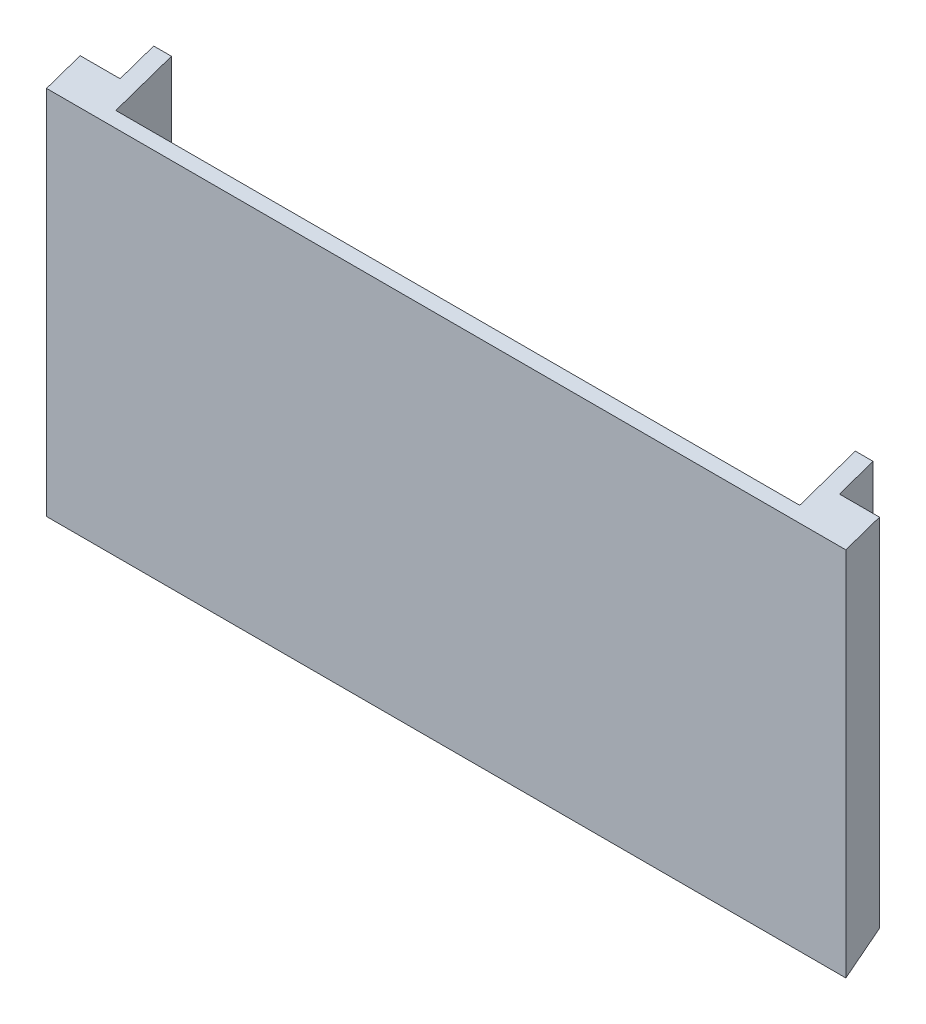
from build123d import *

# Parameters (mm, degrees)
SALIENTE_EXTRUIR1_START    = -22.283463782
SALIENTE_EXTRUIR1_DEPTH    = 135
SALIENTE_EXTRUIR2_START    = -15.533463782
SALIENTE_EXTRUIR2_DEPTH    = 121.5
SALIENTE_EXTRUIR2_2_DEPTH  = 3
SALIENTE_EXTRUIR2_START_2  = 102.966536218
SALIENTE_EXTRUIR2_3_DEPTH  = 3
CORTAR_EXTRUIR1_DEPTH      = 10
CORTAR_EXTRUIR1_DEPTH_BACK = 148
CHAFL_N1_SIZE              = 5
CHAFL_N1_SIZE2             = 3.934668741
CROQUIS5_W                 = 11.5
CROQUIS5_H                 = 16.108624933
SALIENTE_EXTRUIR3_DEPTH    = 8
CORTAR_EXTRUIR2_DEPTH      = 14.8
REDONDEO1_R                = 3
CROQUIS7_R                 = 2
CROQUIS7_R_2               = 3
CROQUIS7_R_3               = 1.25
SALIENTE_EXTRUIR4_DEPTH    = 5


# Read off the part's stored shape, not the designer's step: Saliente-Extruir1, Saliente-Extruir2
with BuildPart() as part:
    # Saliente-Extruir1 outline → Saliente-Extruir1 (new body)
    with BuildSketch(Plane.YZ.offset(SALIENTE_EXTRUIR1_START)):
        Polygon((-75.458190571, 5.674155302), (-73.507815836, 0), (-2.064199728, 0), (-4.014574463, 5.674155302), align=None)
    extrude(amount=SALIENTE_EXTRUIR1_DEPTH)

    # Saliente-Extruir2 outline → Saliente-Extruir2 (add)
    with BuildSketch(Plane.YZ.offset(SALIENTE_EXTRUIR2_START)):
        Polygon((-63.757815836, 0), (-66.757815836, 0), (-64.807441101, -5.674155302), (-61.807441101, -5.674155302), align=None)
    extrude(amount=SALIENTE_EXTRUIR2_DEPTH)

    # Saliente-Extruir2 2 outline → Saliente-Extruir2 2 (add)
    with BuildSketch(Plane.YZ.offset(SALIENTE_EXTRUIR2_START)):
        Polygon((-2.064199728, 0), (-63.757815836, 0), (-61.807441101, -5.674155302), (-0.113824993, -5.674155302), align=None)
    extrude(amount=SALIENTE_EXTRUIR2_2_DEPTH)

    # Saliente-Extruir2 3 outline → Saliente-Extruir2 3 (add)
    with BuildSketch(Plane.YZ.offset(SALIENTE_EXTRUIR2_START_2)):
        Polygon((-2.064199728, 0), (-63.757815836, 0), (-61.807441101, -5.674155302), (-0.113824993, -5.674155302), align=None)
    extrude(amount=SALIENTE_EXTRUIR2_3_DEPTH)

    # Croquis3 → Cortar-Extruir1 (cut, two sides: drawn at the far end of the back side and taken through both)
    with BuildSketch(Plane(origin=(105.966536218, 0, 0), x_dir=(0, 0, -1), z_dir=(1, 0, 0)).offset(-CORTAR_EXTRUIR1_DEPTH_BACK)):
        Polygon((137.63492959, 43.681305963), (7.625291737, -57.488760722), (7.625291737, -67.23888859), (-5.407688567, -80.271868893), (-9.341803419, -77.990953795), (-7.87522913, -69.550856699), (-8.264975448, -68.650724899), (138.464177577, 45.530026939), align=None)
    extrude(amount=CORTAR_EXTRUIR1_DEPTH + CORTAR_EXTRUIR1_DEPTH_BACK, mode=Mode.SUBTRACT)

    # Chaflán1
    chafl_n1_edges = [part.edges().sort_by_distance(p)[0] for p in [
        (45.216536218, -2.064199728, 0),
    ]]
    chafl_n1_side = [part.faces().sort_by_distance(p)[0] for p in [
        (45.216536218, -32.141669504, 0),
    ]]
    chamfer(chafl_n1_edges, length=CHAFL_N1_SIZE, length2=CHAFL_N1_SIZE2, reference=chafl_n1_side[0])

    # Croquis5 → Saliente-Extruir3 (add)
    with BuildSketch(Plane(origin=(0, 0, 0), x_dir=(-1, 0, 0), z_dir=(0, 0, -1))):
        with Locations((-44.930876317, -31.711417234)):
            Rectangle(CROQUIS5_W, CROQUIS5_H)
    extrude(amount=SALIENTE_EXTRUIR3_DEPTH)

    # Croquis6 → Cortar-Extruir2 (cut)
    with BuildSketch(Plane(origin=(50.680876317, 0, 0), x_dir=(0, 0, -1), z_dir=(1, 0, 0))):
        with BuildLine():
            Line((5.9, -36.7657297), (5.9, -26.657104767))
            ThreePointArc((5.9, -26.657104767), (4, -24.757104767), (2.1, -26.657104767))
            Line((2.1, -26.657104767), (2.1, -36.7657297))
            ThreePointArc((2.1, -36.7657297), (4, -38.6657297), (5.9, -36.7657297))
        make_face()
    extrude(amount=-CORTAR_EXTRUIR2_DEPTH, mode=Mode.SUBTRACT)

    # Redondeo1
    redondeo1_edges = [part.edges().sort_by_distance(p)[0] for p in [
        (44.930876317, -23.657104767, -8),
        (44.930876317, -39.7657297, -8),
    ]]
    fillet(redondeo1_edges, radius=REDONDEO1_R)

    # Croquis7 → Saliente-Extruir4 (add)
    # profile 1 of 3: a face of its own
    with BuildSketch(Plane(origin=(0, 0, 0), x_dir=(-1, 0, 0), z_dir=(0, 0, -1))):
        with Locations(Location((-84.06385674, -47.697252062, 0), (0, 0, 180))):
            Circle(CROQUIS7_R)
    # profile 2 of 3: a face of its own
    with BuildSketch(Plane(origin=(0, 0, 0), x_dir=(-1, 0, 0), z_dir=(0, 0, -1))):
        with Locations(Location((-93.07385674, -15.807252062, 0), (0, 0, 180))):
            Circle(CROQUIS7_R_2)
        with Locations((-93.07385674, -15.807252062)):
            Circle(CROQUIS7_R_3, mode=Mode.SUBTRACT)
    # profile 3 of 3: a face of its own
    with BuildSketch(Plane(origin=(0, 0, 0), x_dir=(-1, 0, 0), z_dir=(0, 0, -1))):
        with Locations(Location((-75.23385674, -15.807252062, 0), (0, 0, 180))):
            Circle(CROQUIS7_R_2)
        with Locations((-75.23385674, -15.807252062)):
            Circle(CROQUIS7_R_3, mode=Mode.SUBTRACT)
    extrude(amount=SALIENTE_EXTRUIR4_DEPTH)


solid = part.part
